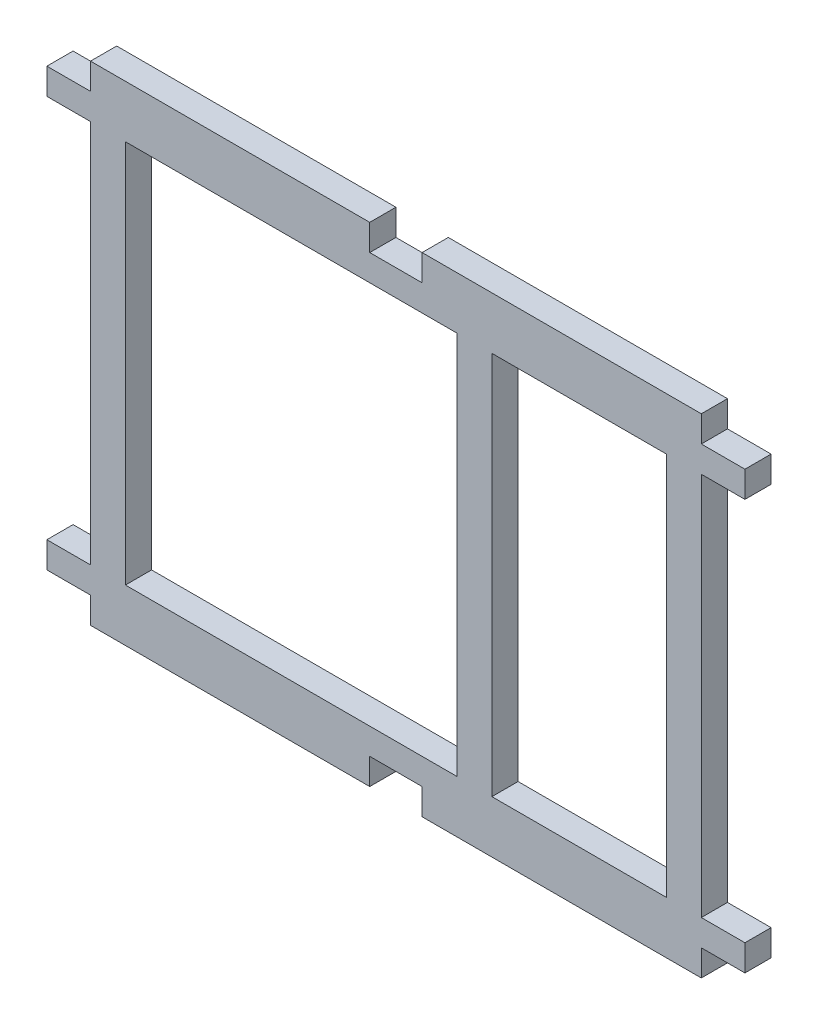
from build123d import *

# Parameters (mm, degrees)
SKETCH1_W           = 38
SKETCH1_H           = 44
SKETCH1_W_2         = 20
BOSS_EXTRUDE1_DEPTH = 3


with BuildPart() as part:
    # Sketch1 → Boss-Extrude1 (new body)
    with BuildSketch(Plane.XY):
        Polygon((-41.282447519, 37.190929465), (-36.282447519, 37.190929465), (-36.282447519, -6.809070535), (-41.282447519, -6.809070535), (-41.282447519, -9.809070535), (-36.282447519, -9.809070535), (-36.282447519, -12.809070535), (-4.282447519, -12.809070535), (-4.282447519, -9.809070535), (1.717552481, -9.809070535), (1.717552481, -12.809070535), (33.717552481, -12.809070535), (33.717552481, -9.809070535), (38.717552481, -9.809070535), (38.717552481, -6.809070535), (33.717552481, -6.809070535), (33.717552481, 37.190929465), (38.717552481, 37.190929465), (38.717552481, 40.190929465), (33.717552481, 40.190929465), (33.717552481, 43.190929465), (1.717552481, 43.190929465), (1.717552481, 40.190929465), (-4.282447519, 40.190929465), (-4.282447519, 43.190929465), (-36.282447519, 43.190929465), (-36.282447519, 40.190929465), (-41.282447519, 40.190929465), align=None)
        with Locations((-13.282447519, 15.190929465)):
            Rectangle(SKETCH1_W, SKETCH1_H, mode=Mode.SUBTRACT)
        with Locations((19.717552481, 15.190929465)):
            Rectangle(SKETCH1_W_2, SKETCH1_H, mode=Mode.SUBTRACT)
    extrude(amount=BOSS_EXTRUDE1_DEPTH)


solid = part.part
